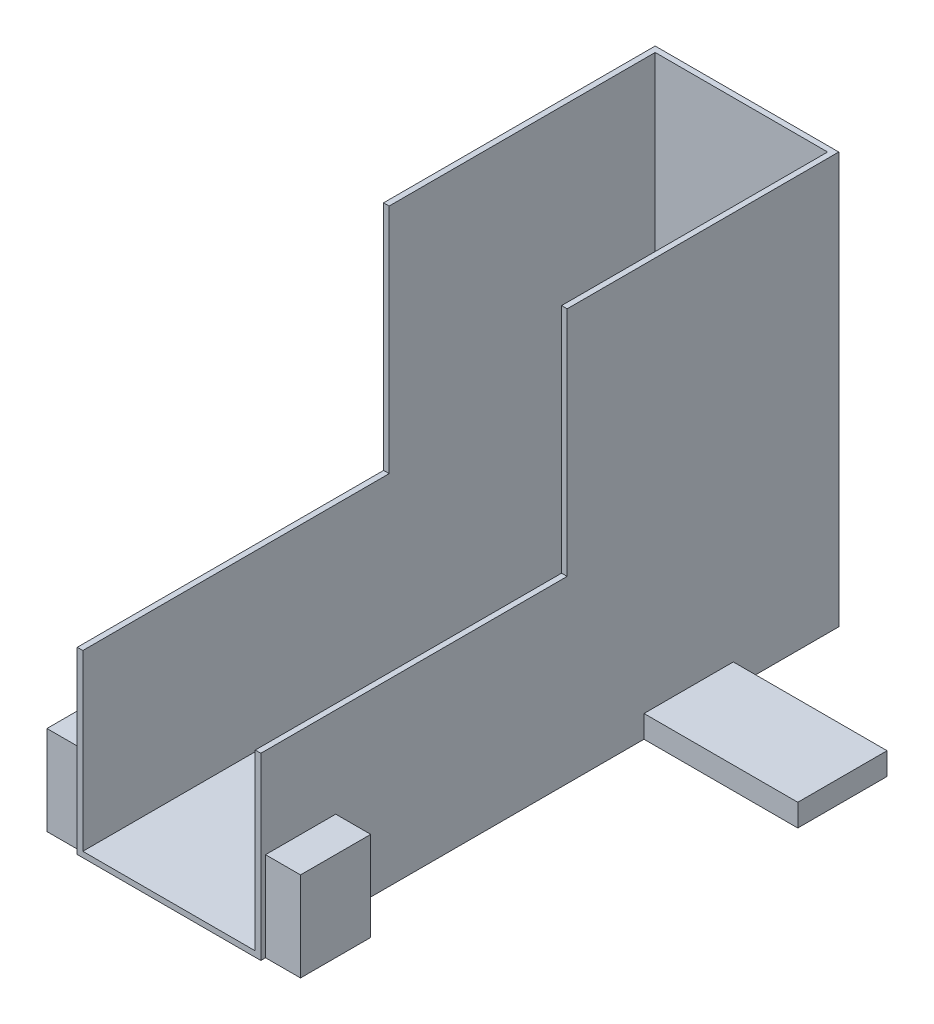
from build123d import *

# Parameters (mm, degrees)
BOSS_EXTRUDE1_DEPTH = 6.35
SKETCH17_W          = 196.1896
SKETCH17_H          = 657.6157706
BOSS_EXTRUDE2_DEPTH = 6.35
SKETCH18_W          = 208.8896
SKETCH18_H          = 467.912654328
BOSS_EXTRUDE3_DEPTH = 6.35
SKETCH20_W          = 174.9552
SKETCH20_H          = 101.6
BOSS_EXTRUDE4_DEPTH = 25.4
SKETCH22_W          = 39.8272
SKETCH22_H          = 79.88897833
BOSS_EXTRUDE5_DEPTH = 101.6


with BuildPart() as part:
    # Sketch15 → Boss-Extrude1 (new body)
    with BuildSketch(Plane(origin=(0, 0, 0), x_dir=(0, 0, -1), z_dir=(1, 0, 0))):
        Polygon((0, 0), (-657.6157706, 0), (-657.6157706, 204.204861602), (-309.033798252, 204.204861602), (-309.033798252, 467.912654328), (0, 467.912654328), align=None)
    boss_extrude1 = extrude(amount=-BOSS_EXTRUDE1_DEPTH)

    # Sketch17 → Boss-Extrude2 (add)
    with BuildSketch(Plane(origin=(0, 0, 0), x_dir=(1, 0, 0), z_dir=(0, 1, 0))):
        with Locations((98.0948, -328.8078853)):
            Rectangle(SKETCH17_W, SKETCH17_H)
    extrude(amount=BOSS_EXTRUDE2_DEPTH)

    # Mirror1: Boss-Extrude1 across plane
    add(boss_extrude1.mirror(Plane(origin=(98.0948, 0, 0), x_dir=(0, 0, 1), z_dir=(1, 0, 0))))

    # Sketch18 → Boss-Extrude3 (add)
    with BuildSketch(Plane(origin=(0, 0, 0), x_dir=(-1, 0, 0), z_dir=(0, 0, -1))):
        with Locations((-98.0948, 233.956327164)):
            Rectangle(SKETCH18_W, SKETCH18_H)
    extrude(amount=-BOSS_EXTRUDE3_DEPTH)

    # Sketch20 → Boss-Extrude4 (add)
    with BuildSketch(Plane(origin=(0, 0, 0), x_dir=(1, 0, 0), z_dir=(0, 1, 0))):
        with Locations((-93.8276, -170.785936787)):
            Rectangle(SKETCH20_W, SKETCH20_H)
        with Locations((290.0172, -170.785936787)):
            Rectangle(SKETCH20_W, SKETCH20_H)
    extrude(amount=BOSS_EXTRUDE4_DEPTH)

    # Sketch22 → Boss-Extrude5 (add)
    with BuildSketch(Plane(origin=(0, 0, 0), x_dir=(1, 0, 0), z_dir=(0, 1, 0))):
        with Locations((-26.2636, -612.31684817)):
            Rectangle(SKETCH22_W, SKETCH22_H)
        with Locations((222.4532, -612.31684817)):
            Rectangle(SKETCH22_W, SKETCH22_H)
    extrude(amount=BOSS_EXTRUDE5_DEPTH)


solid = part.part
